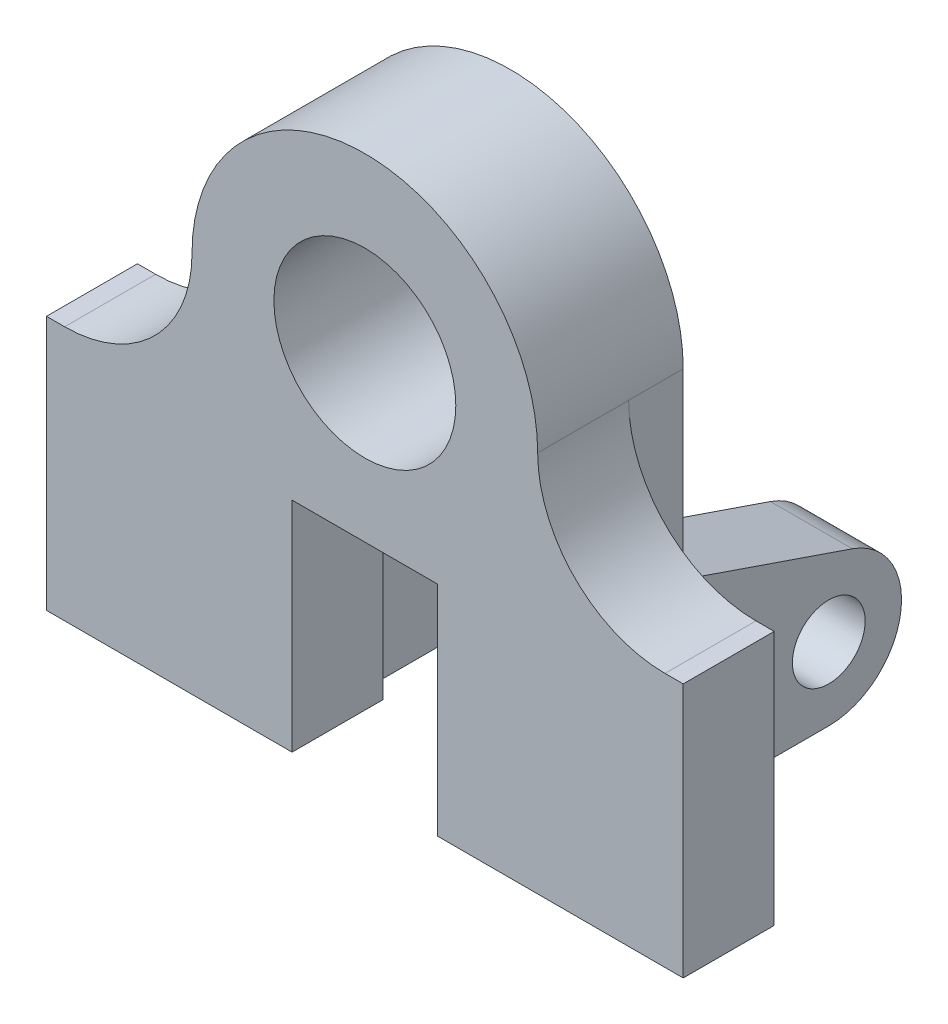
from build123d import *

# Parameters (mm, degrees)
BOSS_EXTRUDE2_DEPTH = 10
FILLET3_R           = 28
SKETCH4_W           = 22
SKETCH4_H           = 48
BOSS_EXTRUDE4_DEPTH = 20
SKETCH9_W           = 18
SKETCH9_H           = 48
BOSS_EXTRUDE6_DEPTH = 60
CUT_EXTRUDE2_DEPTH  = 60
SKETCH12_W          = 18
SKETCH12_H          = 48
BOSS_EXTRUDE7_DEPTH = 60
CUT_EXTRUDE3_START  = -60
CUT_EXTRUDE3_DEPTH  = 60
SKETCH14_R          = 8
CUT_EXTRUDE4_DEPTH  = 140
SKETCH15_R          = 20
CUT_EXTRUDE5_DEPTH  = 140
SKETCH18_R          = 20
BOSS_EXTRUDE9_DEPTH = 12


with BuildPart() as part:
    # Sketch2 → Boss-Extrude2 (new, symmetric)
    with BuildSketch(Plane.XY):
        with BuildLine():
            Line((32, 0), (0, 0))
            Line((0, 0), (0, -56))
            Line((0, -56), (32, -56))
            Line((32, -56), (32, -8))
            Line((32, -8), (89.338383838, -8))
            Line((89.338383838, -8), (108, -8))
            Line((108, -8), (108, -56))
            Line((108, -56), (140, -56))
            Line((140, -56), (140, 0))
            Line((140, 0), (108, 0))
            Line((108, 0), (108, 28))
            ThreePointArc((108, 28), (70, 66), (32, 28))
            Line((32, 28), (32, 0))
        make_face()
    extrude(amount=BOSS_EXTRUDE2_DEPTH, both=True)

    # Fillet3
    fillet3_edges = [part.edges().sort_by_distance(p)[0] for p in [
        (32, 0, 0),
        (108, 0, 0),
    ]]
    fillet(fillet3_edges, radius=FILLET3_R - 0.0001)  # a hair under: the kernel refuses the full size

    # Sketch4 → Boss-Extrude4 (add, through all)
    with BuildSketch(Plane.XY.offset(10)):
        with Locations((97, -32)):
            Rectangle(SKETCH4_W, SKETCH4_H)
        with Locations((43, -32)):
            Rectangle(SKETCH4_W, SKETCH4_H)
    extrude(amount=-BOSS_EXTRUDE4_DEPTH)

    # Sketch9 → Boss-Extrude6 (add)
    with BuildSketch(Plane(origin=(0, 0, -10), x_dir=(-1, 0, 0), z_dir=(0, 0, -1))):
        with Locations((-99, -32)):
            Rectangle(SKETCH9_W, SKETCH9_H)
    extrude(amount=BOSS_EXTRUDE6_DEPTH)

    # Sketch10 → Cut-Extrude2 (cut)
    with BuildSketch(Plane(origin=(108, 0, 0), x_dir=(0, 0, -1), z_dir=(1, 0, 0))):
        with BuildLine():
            Line((70, -8), (10, -8))
            Line((10, -8), (59.189189189, -24.864864865))
            ThreePointArc((59.189189189, -24.864864865), (67.019735539, -30.7001889), (70, -40))
            Line((70, -40), (70, -8))
        make_face()
        with BuildLine():
            Line((70, -56), (70, -40))
            ThreePointArc((70, -40), (65.313708499, -51.313708499), (54, -56))
            Line((54, -56), (70, -56))
        make_face()
    extrude(amount=-CUT_EXTRUDE2_DEPTH, mode=Mode.SUBTRACT)

    # Sketch12 → Boss-Extrude7 (add)
    with BuildSketch(Plane(origin=(0, 0, -10), x_dir=(-1, 0, 0), z_dir=(0, 0, -1))):
        with Locations((-41, -32)):
            Rectangle(SKETCH12_W, SKETCH12_H)
    extrude(amount=BOSS_EXTRUDE7_DEPTH)

    # Sketch13 → Cut-Extrude3 (cut)
    with BuildSketch(Plane.ZY.offset(-32).offset(CUT_EXTRUDE3_START)):
        with BuildLine():
            Line((-70, -8), (-70, -40))
            ThreePointArc((-70, -40), (-67.019735539, -30.7001889), (-59.189189189, -24.864864865))
            Line((-59.189189189, -24.864864865), (-10, -8))
            Line((-10, -8), (-70, -8))
        make_face()
        with BuildLine():
            Line((-70, -40), (-70, -56))
            Line((-70, -56), (-54, -56))
            ThreePointArc((-54, -56), (-65.313708499, -51.313708499), (-70, -40))
        make_face()
    extrude(amount=CUT_EXTRUDE3_DEPTH, mode=Mode.SUBTRACT)

    # Sketch14 → Cut-Extrude4 (cut)
    with BuildSketch(Plane(origin=(108, 0, 0), x_dir=(0, 0, -1), z_dir=(1, 0, 0))):
        with Locations((54, -40)):
            Circle(SKETCH14_R)
    extrude(amount=-CUT_EXTRUDE4_DEPTH, mode=Mode.SUBTRACT)

    # Sketch15 → Cut-Extrude5 (cut)
    with BuildSketch(Plane(origin=(0, 0, -10), x_dir=(-1, 0, 0), z_dir=(0, 0, -1))):
        with Locations((-70, 28)):
            Circle(SKETCH15_R)
    extrude(amount=-CUT_EXTRUDE5_DEPTH, mode=Mode.SUBTRACT)

    # Sketch18 → Boss-Extrude9 (add)
    with BuildSketch(Plane(origin=(0, 0, -10), x_dir=(-1, 0, 0), z_dir=(0, 0, -1))):
        with BuildLine():
            Line((-108, 28), (-108, -8))
            Line((-108, -8), (-32, -8))
            Line((-32, -8), (-32, 28))
            ThreePointArc((-32, 28), (-70, 66), (-108, 28))
        make_face()
        with Locations((-70, 28)):
            Circle(SKETCH18_R, mode=Mode.SUBTRACT)
    extrude(amount=BOSS_EXTRUDE9_DEPTH)


solid = part.part
